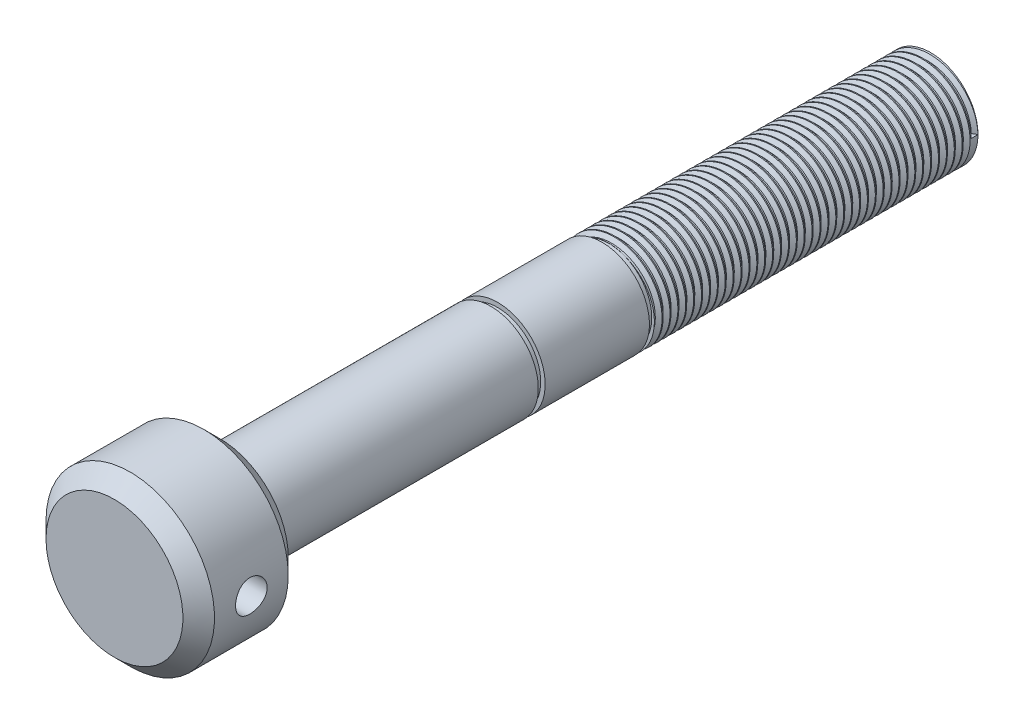
from build123d import *

# Parameters (mm, degrees)
SKETCH1_R               = 16
BOSS_EXTRUDE1_DEPTH     = 20
CHAMFER1_SIZE           = 3
SKETCH2_R               = 9
BOSS_EXTRUDE2_DEPTH     = 135
SKETCH3_W               = 1.3
SKETCH3_H               = 0.85
CUT_EXTRUDE1_DEPTH      = 137.883161857
CUT_EXTRUDE1_DEPTH_BACK = 137.883161857
THREAD1_PITCH           = 1.5


with BuildPart() as part:
    # Sketch1 → Boss-Extrude1 (new body)
    with BuildSketch(Plane.XY):
        Circle(SKETCH1_R)
    extrude(amount=BOSS_EXTRUDE1_DEPTH)

    # Chamfer1
    chamfer1_edges = [part.edges().sort_by_distance(p)[0] for p in [
        (-16, 0, 0),
        (-16, 0, 20),
    ]]
    chamfer(chamfer1_edges, length=CHAMFER1_SIZE)

    # Sketch2 → Boss-Extrude2 (add)
    with BuildSketch(Plane(origin=(0, 0, 0), x_dir=(-1, 0, 0), z_dir=(0, 0, -1))):
        Circle(SKETCH2_R)
    extrude(amount=BOSS_EXTRUDE2_DEPTH)

    # Sketch3 → Cut-Revolve1 (revolve, cut)
    with BuildSketch(Plane(origin=(0, 0, 0), x_dir=(0, 0, -1), z_dir=(1, 0, 0)), mode=Mode.PRIVATE) as cut_revolve1_sk:
        with Locations((52.15, 8.575)):
            Rectangle(SKETCH3_W, SKETCH3_H)
        with Locations((73.25, 8.575)):
            Rectangle(SKETCH3_W, SKETCH3_H)
    revolve(cut_revolve1_sk.sketch.rotate(Axis((0, 0, -135), (0, 0, 1)), 90), axis=Axis((0, 0, -135), (0, 0, 1)), mode=Mode.SUBTRACT)

    # Sketch4 → Cut-Extrude1 (cut, two sides: drawn at the far end of the back side and taken through both)
    with BuildSketch(Plane(origin=(0, 0, 0), x_dir=(0, 0, -1), z_dir=(1, 0, 0)).offset(-CUT_EXTRUDE1_DEPTH_BACK)):
        with BuildLine():
            ThreePointArc((-13, 0), (-10, -3), (-7, 0))
            Line((-7, 0), (-13, 0))
        make_face()
        with BuildLine():
            Line((-13, 0), (-7, 0))
            ThreePointArc((-7, 0), (-10, 3), (-13, 0))
        make_face()
    extrude(amount=CUT_EXTRUDE1_DEPTH + CUT_EXTRUDE1_DEPTH_BACK, mode=Mode.SUBTRACT)

    # Thread1: arcs per turn and ends read off the stored shape
    # Thread1: the profile of Thread Profile1 profile screwed along a right-hand helix through 40.733333 turns, 8 arcs to a turn; built about Z, then put on its axis
    thread1_z = Axis((0, 0, 0), (0, 0, 1))
    thread1_corners = [(9.0003, 0, -0.000173205), (9.0003, 0, 1.312673201), (8.188101188, 0, 0.843749998), (8.188101188, 0, 0.468749998)]
    with BuildLine(mode=Mode.PRIVATE) as thread1_profile:
        Line(thread1_corners[0], thread1_corners[1])
        Line(thread1_corners[1], thread1_corners[2])
        Line(thread1_corners[2], thread1_corners[3])
        Line(thread1_corners[3], thread1_corners[0])
    thread1_cap = Face(thread1_profile.wire())
    thread1_turn_angles = [0, 22.5, 45, 67.5, 90, 112.5, 135, 157.5, 180, 202.5, 225, 247.5, 270, 292.5, 315, 337.5, 360]
    thread1_turn_weights = [1, 0.9238795325112867, 1, 0.9238795325112867, 1, 0.9238795325112867, 1, 0.9238795325112867, 1, 0.9238795325112867, 1, 0.9238795325112867, 1, 0.9238795325112867, 1, 0.9238795325112867, 1]
    thread1_turn_rails = [Edge.make_bspline([Vector(p[0], p[1], 0).rotate(thread1_z, thread1_turn_angles[k]) / thread1_turn_weights[k] + Vector(0, 0, p[2] + THREAD1_PITCH * thread1_turn_angles[k] / 360) for k in range(17)], [0, 0, 0, 1, 1, 2, 2, 3, 3, 4, 4, 5, 5, 6, 6, 7, 7, 8, 8, 8], 2, thread1_turn_weights) for p in thread1_corners]
    thread1_turn_sides = [Face.make_surface_from_curves(thread1_turn_rails[p[0]], thread1_turn_rails[p[1]]) for p in [(0, 1), (1, 2), (2, 3), (3, 0)]]
    thread1_last_angles = [14400, 14422.5, 14445, 14467.5, 14490, 14512.5, 14535, 14557.5, 14580, 14602.5, 14625, 14644.5, 14664]
    thread1_last_weights = [1, 0.9238795325112867, 1, 0.9238795325112867, 1, 0.9238795325112867, 1, 0.9238795325112867, 1, 0.9238795325112867, 1, 0.9426414910921731, 1]
    thread1_last_rails = [Edge.make_bspline([Vector(p[0], p[1], 0).rotate(thread1_z, thread1_last_angles[k]) / thread1_last_weights[k] + Vector(0, 0, p[2] + THREAD1_PITCH * thread1_last_angles[k] / 360) for k in range(13)], [0, 0, 0, 1, 1, 2, 2, 3, 3, 4, 4, 5, 5, 6, 6, 6], 2, thread1_last_weights) for p in thread1_corners]
    thread1_last_sides = [Face.make_surface_from_curves(thread1_last_rails[p[0]], thread1_last_rails[p[1]]) for p in [(0, 1), (1, 2), (2, 3), (3, 0)]]
    thread1 = Plane(origin=(0, 0, -135), x_dir=(1, 0, 0), z_dir=(0, 0, 1)) * Solid(Shell([*[p.moved(Location((0, 0, THREAD1_PITCH * i))) for i in range(40) for p in thread1_turn_sides], *thread1_last_sides, thread1_cap, thread1_cap.rotate(thread1_z, 14664).moved(Location((0, 0, THREAD1_PITCH * 14664 / 360)))]))
    add(thread1, mode=Mode.SUBTRACT)


solid = part.part
